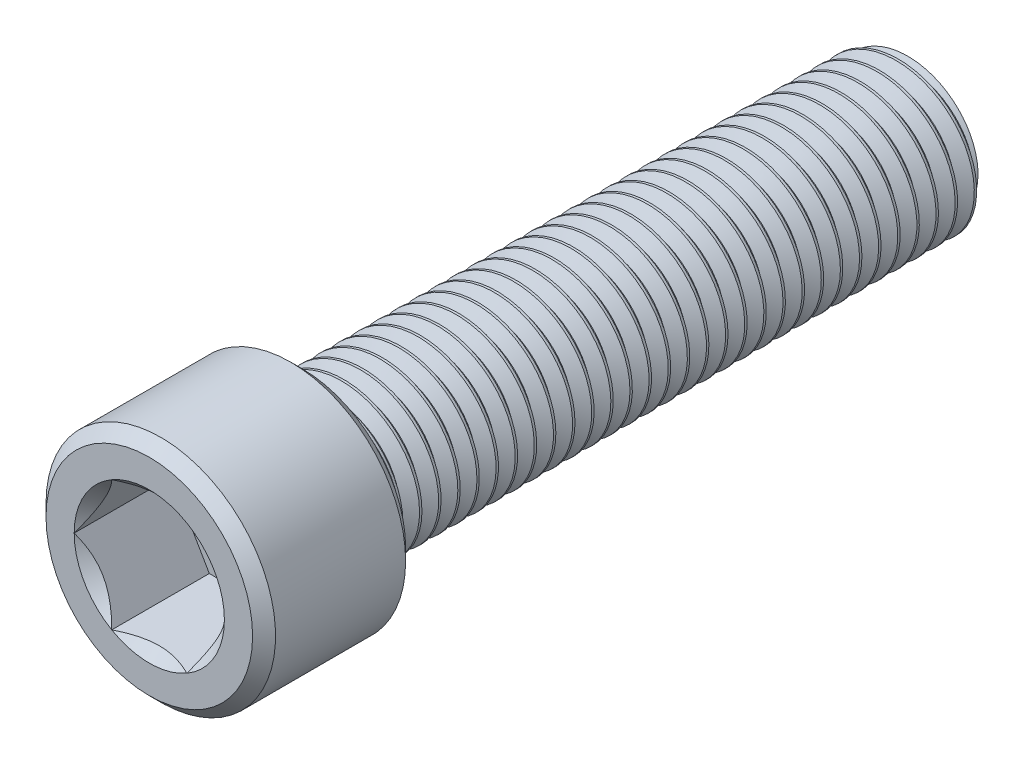
from build123d import *

# Parameters (mm, degrees)
SKETCH1_R           = 10
BOSS_EXTRUDE1_DEPTH = 80
CUT_SWEEP1_PITCH    = 2.5
SKETCH5_R           = 15
BOSS_EXTRUDE2_DEPTH = 20
CUT_EXTRUDE1_DEPTH  = 12.75
CHAMFER1_SIZE       = 1.5


with BuildPart() as part:
    # Sketch1 → Boss-Extrude1 (new body)
    with BuildSketch(Plane.XY):
        Circle(SKETCH1_R)
    extrude(amount=BOSS_EXTRUDE1_DEPTH)

    # Cut-Sweep1: the profile of Sketch3 screwed along a right-hand helix of 42 turns, 10 arcs to a turn; built about Z, then put on its axis
    cut_sweep1_z = Axis((0, 0, 0), (0, 0, 1))
    cut_sweep1_corners = [(10, 0, 0), (10, 0.086949166, -2.185270885), (8.377068393, 0.049696597, -1.249011709), (8.377068393, 0.037252569, -0.936259177)]
    with BuildLine(mode=Mode.PRIVATE) as cut_sweep1_profile:
        Line(cut_sweep1_corners[0], cut_sweep1_corners[1])
        Line(cut_sweep1_corners[1], cut_sweep1_corners[2])
        Line(cut_sweep1_corners[2], cut_sweep1_corners[3])
        Line(cut_sweep1_corners[3], cut_sweep1_corners[0])
    cut_sweep1_cap = Face(cut_sweep1_profile.wire())
    cut_sweep1_turn_angles = [0, 18, 36, 54, 72, 90, 108, 126, 144, 162, 180, 198, 216, 234, 252, 270, 288, 306, 324, 342, 360, 378, 396, 414, 432, 450, 468, 486, 504, 522, 540, 558, 576, 594, 612, 630, 648, 666, 684, 702, 720]
    cut_sweep1_turn_weights = [1, 0.9510565162951535, 1, 0.9510565162951535, 1, 0.9510565162951535, 1, 0.9510565162951535, 1, 0.9510565162951535, 1, 0.9510565162951535, 1, 0.9510565162951535, 1, 0.9510565162951535, 1, 0.9510565162951535, 1, 0.9510565162951535, 1, 0.9510565162951535, 1, 0.9510565162951535, 1, 0.9510565162951535, 1, 0.9510565162951535, 1, 0.9510565162951535, 1, 0.9510565162951535, 1, 0.9510565162951535, 1, 0.9510565162951535, 1, 0.9510565162951535, 1, 0.9510565162951535, 1]
    cut_sweep1_turn_rails = [Edge.make_bspline([Vector(p[0], p[1], 0).rotate(cut_sweep1_z, cut_sweep1_turn_angles[k]) / cut_sweep1_turn_weights[k] + Vector(0, 0, p[2] + CUT_SWEEP1_PITCH * cut_sweep1_turn_angles[k] / 360) for k in range(41)], [0, 0, 0, 1, 1, 2, 2, 3, 3, 4, 4, 5, 5, 6, 6, 7, 7, 8, 8, 9, 9, 10, 10, 11, 11, 12, 12, 13, 13, 14, 14, 15, 15, 16, 16, 17, 17, 18, 18, 19, 19, 20, 20, 20], 2, cut_sweep1_turn_weights) for p in cut_sweep1_corners]
    cut_sweep1_turn_sides = [Face.make_surface_from_curves(cut_sweep1_turn_rails[p[0]], cut_sweep1_turn_rails[p[1]]) for p in [(0, 1), (1, 2), (2, 3), (3, 0)]]
    cut_sweep1 = Plane(origin=(0, 0, 0), x_dir=(0, 1, 0), z_dir=(0, 0, 1)) * Solid(Shell([*[p.moved(Location((0, 0, 2 * CUT_SWEEP1_PITCH * i))) for i in range(21) for p in cut_sweep1_turn_sides], cut_sweep1_cap, cut_sweep1_cap.rotate(cut_sweep1_z, 15120).moved(Location((0, 0, CUT_SWEEP1_PITCH * 15120 / 360)))]))
    add(cut_sweep1, mode=Mode.SUBTRACT)

    # Sketch4 → Cut-Revolve1 (revolve, cut)
    with BuildSketch(Plane(origin=(0, 0, 0), x_dir=(0, 0, -1), z_dir=(1, 0, 0)), mode=Mode.PRIVATE) as cut_revolve1_sk:
        Polygon((0, 11), (-2.014449198, 11), (0, 8.123068393), align=None)
    revolve(cut_revolve1_sk.sketch.rotate(Axis((0, 0, 0), (0, 0, -1)), 90), axis=Axis((0, 0, 0), (0, 0, -1)), mode=Mode.SUBTRACT)

    # Sketch5 → Boss-Extrude2 (add)
    with BuildSketch(Plane.XY.offset(80)):
        Circle(SKETCH5_R)
    extrude(amount=BOSS_EXTRUDE2_DEPTH)

    # Sketch6 → Cut-Extrude1 (cut)
    with BuildSketch(Plane.XY.offset(100)):
        Polygon((4.907477288, 8.5), (-4.907477288, 8.5), (-9.814954576, 0), (-4.907477288, -8.5), (4.907477288, -8.5), (9.814954576, 0), align=None)
    extrude(amount=-CUT_EXTRUDE1_DEPTH, mode=Mode.SUBTRACT)

    # Cut-Extrude2 cone 1 section (through the dimple's axis) → Cut-Extrude2 (revolve, cut)
    with BuildSketch(Plane(origin=(0, 0, 100), x_dir=(0, -1, 0), z_dir=(1, 0, 0))):
        Polygon((0, 0), (9.814954576, 0), (0, 9.814954576), align=None)
    revolve(axis=Axis((0, 0, 100), (0, 0, -1)), mode=Mode.SUBTRACT)

    # Chamfer1
    chamfer1_edges = [part.edges().sort_by_distance(p)[0] for p in [
        (-15, 0, 80),
        (-15, 0, 100),
    ]]
    chamfer(chamfer1_edges, length=CHAMFER1_SIZE)


solid = part.part
